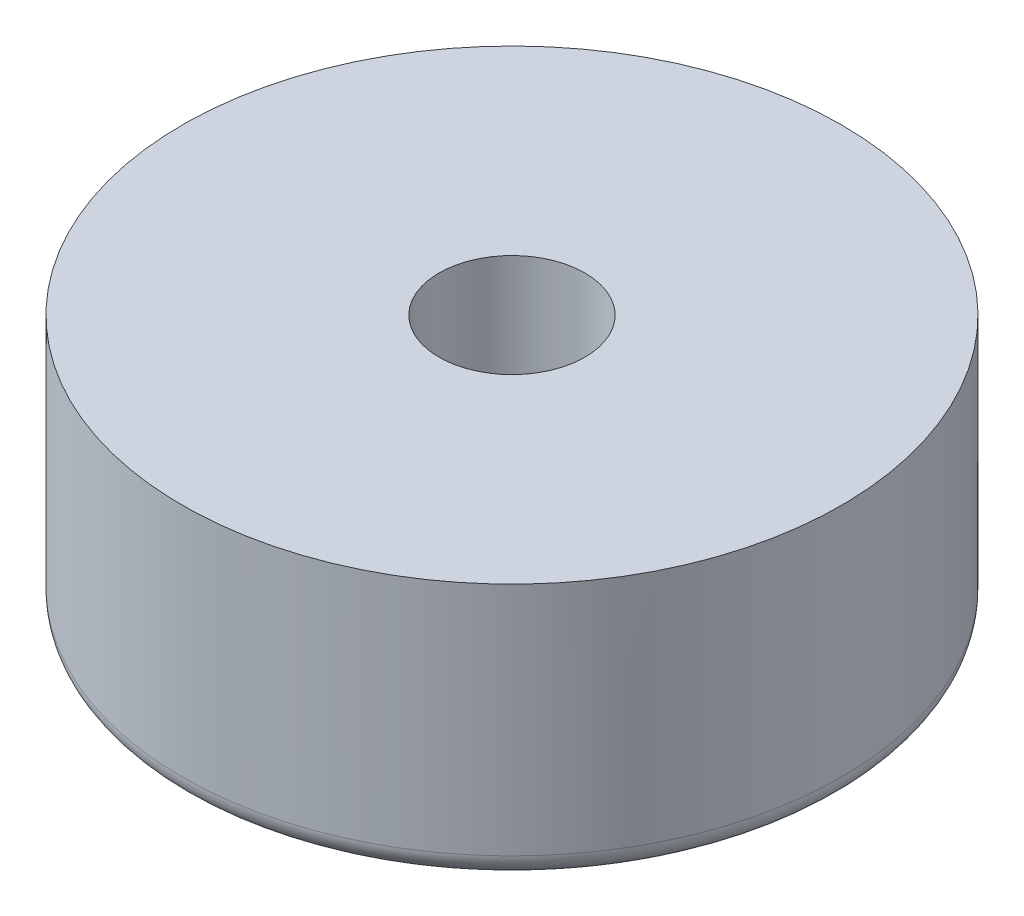
from build123d import *

# Parameters (mm, degrees)
FILLET1_R = 0.5


with BuildPart() as part:
    # Sketch1 → Revolve1 (revolve)
    with BuildSketch(Plane.XY):
        Polygon((-1.55, 0), (-7, 0), (-7, -5.5), (-4, -5.5), (-4, -3.373831776), (-1.55, -3.373831776), align=None)
    revolve(axis=Axis((0, 0, 0), (0, 1, 0)))

    # Fillet1
    fillet1_edges = [part.edges().sort_by_distance(p)[0] for p in [
        (7, -5.5, 0),
        (4, -5.5, 0),
    ]]
    fillet(fillet1_edges, radius=FILLET1_R)


solid = part.part
